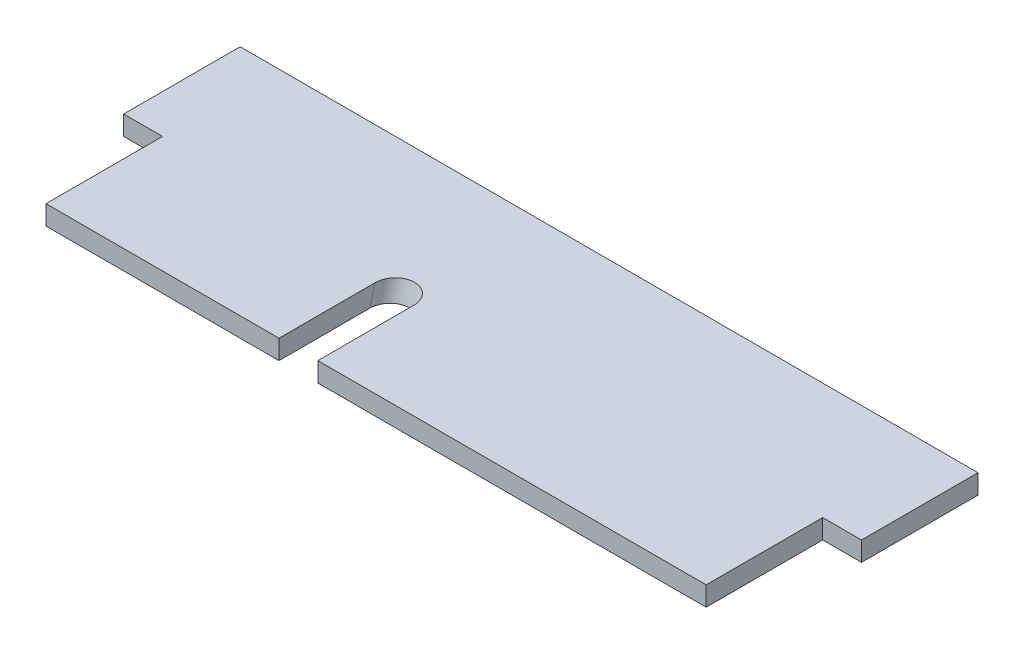
from build123d import *

# Parameters (mm, degrees)
BOSS_EXTRUDE1_DEPTH     = 6.35
CAVITY1_START           = -13.966782317
CAVITY1_OUTLINE_R       = 12.7
CAVITY1_DEPTH           = 20.041848041
CUT_EXTRUDE2_REACH      = 287.468
CUT_EXTRUDE2_END_RADIUS = 12.7
SKETCH6_W               = 25.4
SKETCH6_H               = 12.7


# Read off the part's stored shape, not the designer's step: Cavity1
with BuildPart() as part:
    # Sketch1 → Boss-Extrude1 (new, symmetric)
    with BuildSketch(Plane(origin=(0, 0, 0), x_dir=(1, 0, 0), z_dir=(0, 1, 0))):
        Polygon((-215.9, 76.2), (215.9, 76.2), (241.3, 76.2), (241.3, 0), (215.9, 0), (215.9, -76.2), (-215.9, -76.2), (-215.9, 0), (-241.3, 0), (-241.3, 76.2), align=None)
    extrude(amount=BOSS_EXTRUDE1_DEPTH, both=True)

    # Cavity1 outline → Cavity1 (cut)
    with BuildSketch(Plane(origin=(0, 0, 0), x_dir=(1, 0, 0), z_dir=(0, 0.9651827234760059, -0.261576585923588)).offset(CAVITY1_START)):
        with Locations((-50.8, -14.559690973)):
            Circle(CAVITY1_OUTLINE_R)
    extrude(amount=CAVITY1_DEPTH, mode=Mode.SUBTRACT)

    # Cut-Extrude2: up to this cylinder (the profile starts outside it)
    cut_extrude2_end = Plane(origin=(-50.8, -15.429678905, 19.266542232), z_dir=(0, 0.965182723476006, -0.2615765859235875)) * Cylinder(CUT_EXTRUDE2_END_RADIUS, 601.336, mode=Mode.PRIVATE)
    # Sketch6 → Cut-Extrude2 (cut, up to the surface)
    with BuildSketch(Plane.XY.offset(76.2), mode=Mode.PRIVATE) as cut_extrude2_sk1:
        with Locations((-50.8, 0)):
            Rectangle(SKETCH6_W, SKETCH6_H)
    cut_extrude2_tool1 = extrude(cut_extrude2_sk1.sketch, amount=-CUT_EXTRUDE2_REACH, mode=Mode.PRIVATE) - cut_extrude2_end
    add(cut_extrude2_tool1.solids().sort_by_distance((-50.8, 0, 76.2))[0], mode=Mode.SUBTRACT)


solid = part.part
